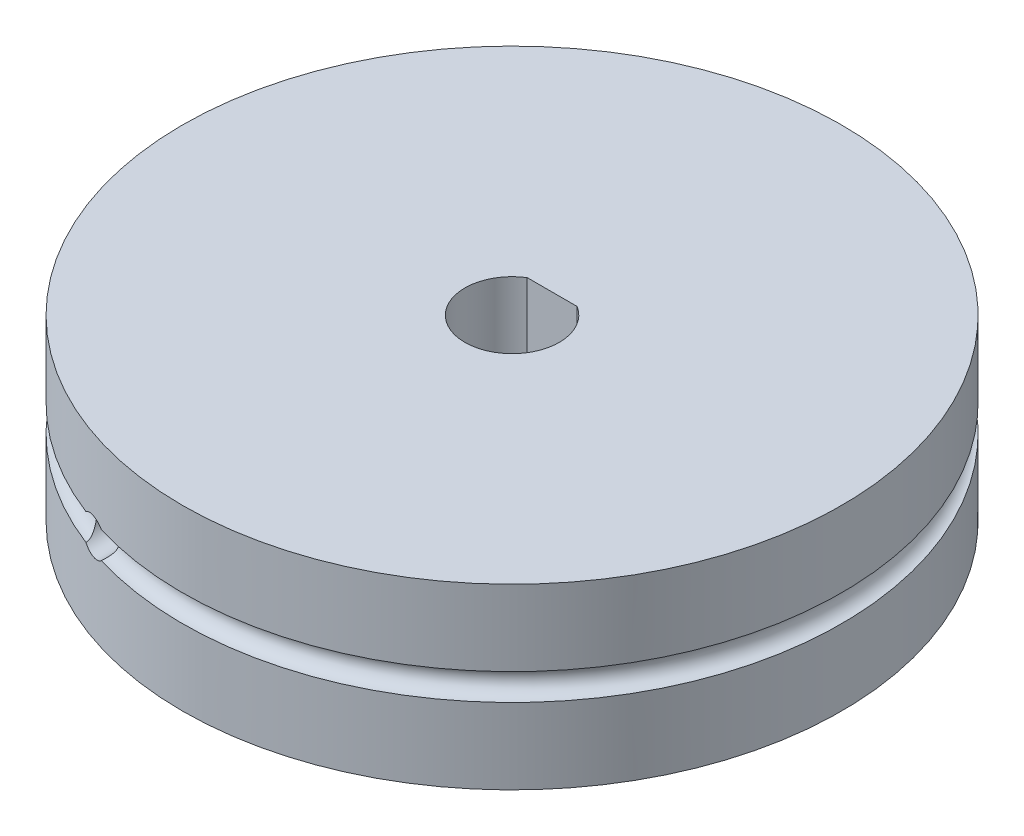
from build123d import *

# Parameters (mm, degrees)
SKETCH1_R                      = 18.5
BOSS_EXTRUDE1_DEPTH            = 10
SKETCH2_R                      = 0.75
CUT_EXTRUDE1_REACH             = 30.009
CUT_EXTRUDE2_REACH             = 30.009
SKETCH4_R                      = 1
CUT_EXTRUDE2_DIRECTION_2_REACH = 30.009


with BuildPart() as part:
    # Sketch1 → Boss-Extrude1 (new body)
    with BuildSketch(Plane(origin=(0, 0, 0), x_dir=(1, 0, 0), z_dir=(0, 1, 0))):
        Circle(SKETCH1_R)
    extrude(amount=BOSS_EXTRUDE1_DEPTH)

    # Sketch2 → Cut-Revolve1 (revolve, cut)
    with BuildSketch(Plane.XY):
        with Locations((-18.5, 5)):
            Circle(SKETCH2_R)
    revolve(axis=Axis((0, 22.422972825, 0), (0, -1, 0)), mode=Mode.SUBTRACT)

    # Sketch3 → Cut-Extrude1 (cut, up to next)
    with BuildSketch(Plane(origin=(0, 10, 0), x_dir=(1, 0, 0), z_dir=(0, 1, 0)), mode=Mode.PRIVATE) as cut_extrude1_sk1:
        with BuildLine():
            Line((1.4, 2.25), (-1.4, 2.25))
            ThreePointArc((-1.4, 2.25), (-1.286953768, -2.316516782), (2.65, 0))
            ThreePointArc((2.65, 0), (2.316516782, 1.286953768), (1.4, 2.25))
        make_face()
    cut_extrude1_tool1 = extrude(cut_extrude1_sk1.sketch, amount=-CUT_EXTRUDE1_REACH, mode=Mode.PRIVATE) & part.part
    add(cut_extrude1_tool1.solids().sort_by_distance((0, 10, 0.085872))[0], mode=Mode.SUBTRACT)

    # Sketch4 → Cut-Extrude2 (cut, up to next)
    with BuildSketch(Plane.XY, mode=Mode.PRIVATE) as cut_extrude2_sk1:
        with Locations((-6, 5)):
            Circle(SKETCH4_R)
    cut_extrude2_tool1 = extrude(cut_extrude2_sk1.sketch, amount=-CUT_EXTRUDE2_REACH, mode=Mode.PRIVATE) & part.part
    add(cut_extrude2_tool1.solids().sort_by_distance((-6, 5, 0))[0], mode=Mode.SUBTRACT)

    # Sketch4 → Cut-Extrude2 direction 2 (cut, up to next)
    with BuildSketch(Plane.XY, mode=Mode.PRIVATE) as cut_extrude2_direction_2_sk1:
        with Locations((-6, 5)):
            Circle(SKETCH4_R)
    cut_extrude2_direction_2_tool1 = extrude(cut_extrude2_direction_2_sk1.sketch, amount=CUT_EXTRUDE2_DIRECTION_2_REACH, mode=Mode.PRIVATE) & part.part
    add(cut_extrude2_direction_2_tool1.solids().sort_by_distance((-6, 5, 0))[0], mode=Mode.SUBTRACT)


solid = part.part
